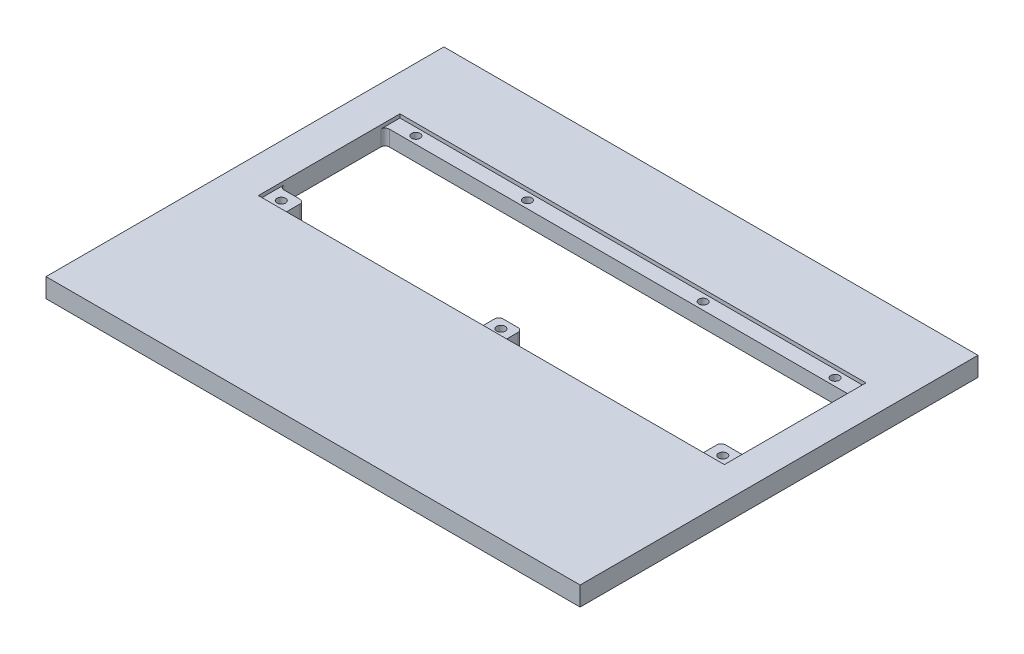
from build123d import *

# Parameters (mm, degrees)
SKETCH1_W           = 250.9
SKETCH1_H           = 186.9
BOSS_EXTRUDE1_DEPTH = 9
SKETCH2_W           = 218.9
SKETCH2_H           = 66.5
CUT_EXTRUDE1_DEPTH  = 9
SKETCH4_W           = 218.9
SKETCH4_H           = 7
SKETCH4_W_2         = 11.5
SKETCH4_H_2         = 10
SKETCH4_W_3         = 11
SKETCH4_H_3         = 9
BOSS_EXTRUDE2_DEPTH = 7.3
SKETCH3_R           = 2
CUT_EXTRUDE2_DEPTH  = 6.6
FILLET1_R           = 2


with BuildPart() as part:
    # Sketch1 → Boss-Extrude1 (new body)
    with BuildSketch(Plane(origin=(0, 0, 0), x_dir=(1, 0, 0), z_dir=(0, 1, 0))):
        with Locations((125.45, 93.45)):
            Rectangle(SKETCH1_W, SKETCH1_H)
    extrude(amount=BOSS_EXTRUDE1_DEPTH)

    # Sketch2 → Cut-Extrude1 (cut)
    with BuildSketch(Plane(origin=(0, 0, 0), x_dir=(1, 0, 0), z_dir=(0, 1, 0))):
        with Locations((126.36, 116.1)):
            Rectangle(SKETCH2_W, SKETCH2_H)
    extrude(amount=CUT_EXTRUDE1_DEPTH, mode=Mode.SUBTRACT)

    # Sketch4 → Boss-Extrude2 (add)
    with BuildSketch(Plane(origin=(0, 0, 0), x_dir=(1, 0, 0), z_dir=(0, 1, 0))):
        with Locations((126.36, 145.85)):
            Rectangle(SKETCH4_W, SKETCH4_H)
        with Locations((230.06, 87.85)):
            Rectangle(SKETCH4_W_2, SKETCH4_H_2)
        with Locations((126.36, 87.35)):
            Rectangle(SKETCH4_W_3, SKETCH4_H_3)
        with Locations((22.66, 87.85)):
            Rectangle(SKETCH4_W_2, SKETCH4_H_2)
    extrude(amount=BOSS_EXTRUDE2_DEPTH)

    # Sketch3 → Cut-Extrude2 (cut)
    with BuildSketch(Plane(origin=(0, 9, 0), x_dir=(1, 0, 0), z_dir=(0, 1, 0))):
        with Locations((27.91, 145.85)):
            Circle(SKETCH3_R)
        with Locations((80.31, 145.85)):
            Circle(SKETCH3_R)
        with Locations((162.81, 145.85)):
            Circle(SKETCH3_R)
        with Locations((224.81, 145.85)):
            Circle(SKETCH3_R)
        with Locations((22.66, 87.85)):
            Circle(SKETCH3_R)
        with Locations((126.36, 87.35)):
            Circle(SKETCH3_R)
        with Locations((230.06, 87.85)):
            Circle(SKETCH3_R)
    extrude(amount=-CUT_EXTRUDE2_DEPTH, mode=Mode.SUBTRACT)

    # Fillet1
    fillet1_edges = [part.edges().sort_by_distance(p)[0] for p in [
        (16.91, 3.65, -92.85),
        (28.41, 3.65, -82.85),
        (28.41, 3.65, -92.85),
        (16.91, 3.65, -142.35),
        (235.81, 3.65, -142.35),
        (235.81, 3.65, -92.85),
        (224.31, 3.65, -82.85),
        (224.31, 3.65, -92.85),
        (120.86, 3.65, -82.85),
        (131.86, 3.65, -82.85),
        (131.86, 3.65, -91.85),
        (120.86, 3.65, -91.85),
    ]]
    fillet(fillet1_edges, radius=FILLET1_R)


solid = part.part
